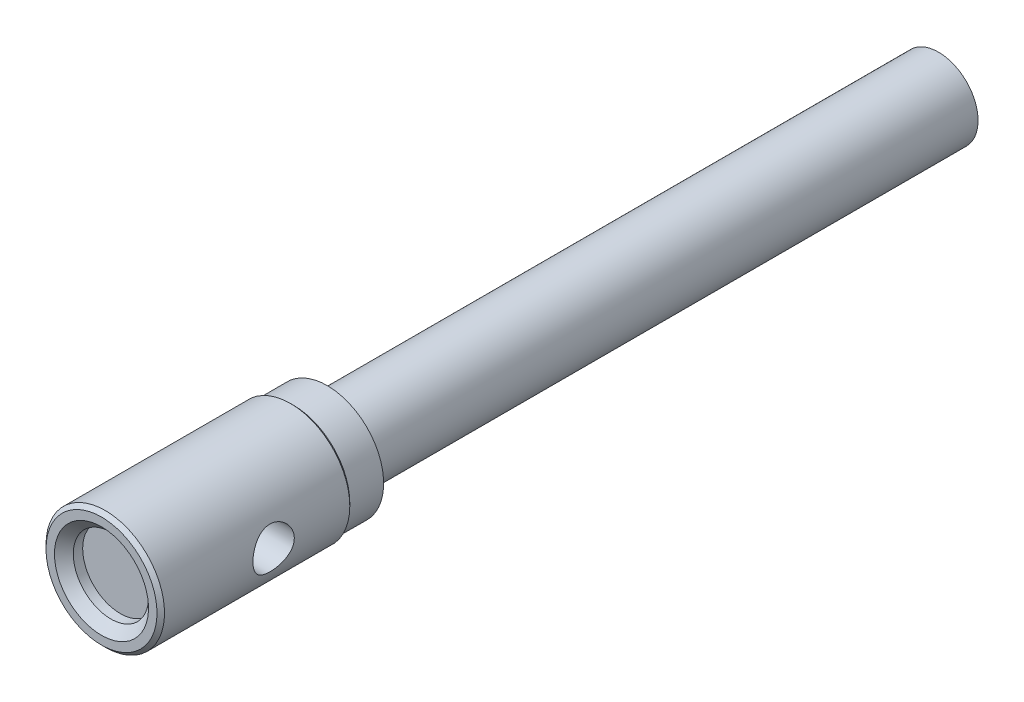
from build123d import *

# Parameters (mm, degrees)
CUT_EXTRUDE_1_DEPTH      = 33.803886965
CUT_EXTRUDE_1_DEPTH_BACK = 33.803886965
SKETCH_3_R               = 1.1
CHAMFER_1_SIZE           = 0.5
CHAMFER_3_SIZE           = 0.2


with BuildPart() as part:
    # 스케치2 → 회전1 (revolve)
    with BuildSketch(Plane(origin=(0, 0, 0), x_dir=(1, 0, 0), z_dir=(0, 1, 0)), mode=Mode.PRIVATE) as revolve_1_sk:
        Polygon((0, 32.5), (0, -11), (2, -11), (2, -12), (3.15, -12), (3.15, -2), (3, -2), (3, 0), (2.1, 0), (2.1, 32.5), align=None)
    revolve(revolve_1_sk.sketch.rotate(Axis((0, 0, -32.5), (0, 0, 1)), 180), axis=Axis((0, 0, -32.5), (0, 0, 1)))

    # 스케치3 → 컷-돌출1 (cut, two sides: drawn at the far end of the back side and taken through both)
    with BuildSketch(Plane(origin=(0, 0, 0), x_dir=(0, 0, -1), z_dir=(1, 0, 0)).offset(-CUT_EXTRUDE_1_DEPTH_BACK)):
        with Locations((-6, 0)):
            Circle(SKETCH_3_R)
    extrude(amount=CUT_EXTRUDE_1_DEPTH + CUT_EXTRUDE_1_DEPTH_BACK, mode=Mode.SUBTRACT)

    # 모따기1
    chamfer_1_edges = [part.edges().sort_by_distance(p)[0] for p in [
        (2, 0, 12),
    ]]
    chamfer(chamfer_1_edges, length=CHAMFER_1_SIZE)

    # 모따기3
    # the kernel refuses this chamfer: 0.2 mm, written as the material it adds along each edge
    with BuildSketch(Plane(origin=(0, 0, 2), x_dir=(-1, 0, 0), z_dir=(0, 1, 0))) as chamfer_3_piece_1_section:
        Polygon((3 + CHAMFER_3_SIZE, 0), (3, -CHAMFER_3_SIZE), (3, 0), align=None)
    chamfer_3_piece_1 = revolve(axis=Axis((0, 0, 2), (0, 0, 1)), mode=Mode.PRIVATE)
    chamfer_3_piece_1 = chamfer_3_piece_1 & Plane(origin=(0, 0, 1.877341944), x_dir=(-1, 0, 0), z_dir=(0, 0, -1)) * Cylinder(3.15, 13, mode=Mode.PRIVATE)
    add(chamfer_3_piece_1)
    # the kernel refuses this chamfer: 0.2 mm, written as the material it takes off along each edge
    with BuildSketch(Plane(origin=(0, 0, 12), x_dir=(-1, 0, 0), z_dir=(0, 1, 0))) as chamfer_3_2_piece_1:
        Polygon((3.15 - CHAMFER_3_SIZE, 0), (3.15, -CHAMFER_3_SIZE), (3.15, 0), align=None)
    revolve(axis=Axis((0, 0, 12), (0, 0, 1)), mode=Mode.SUBTRACT)


solid = part.part
